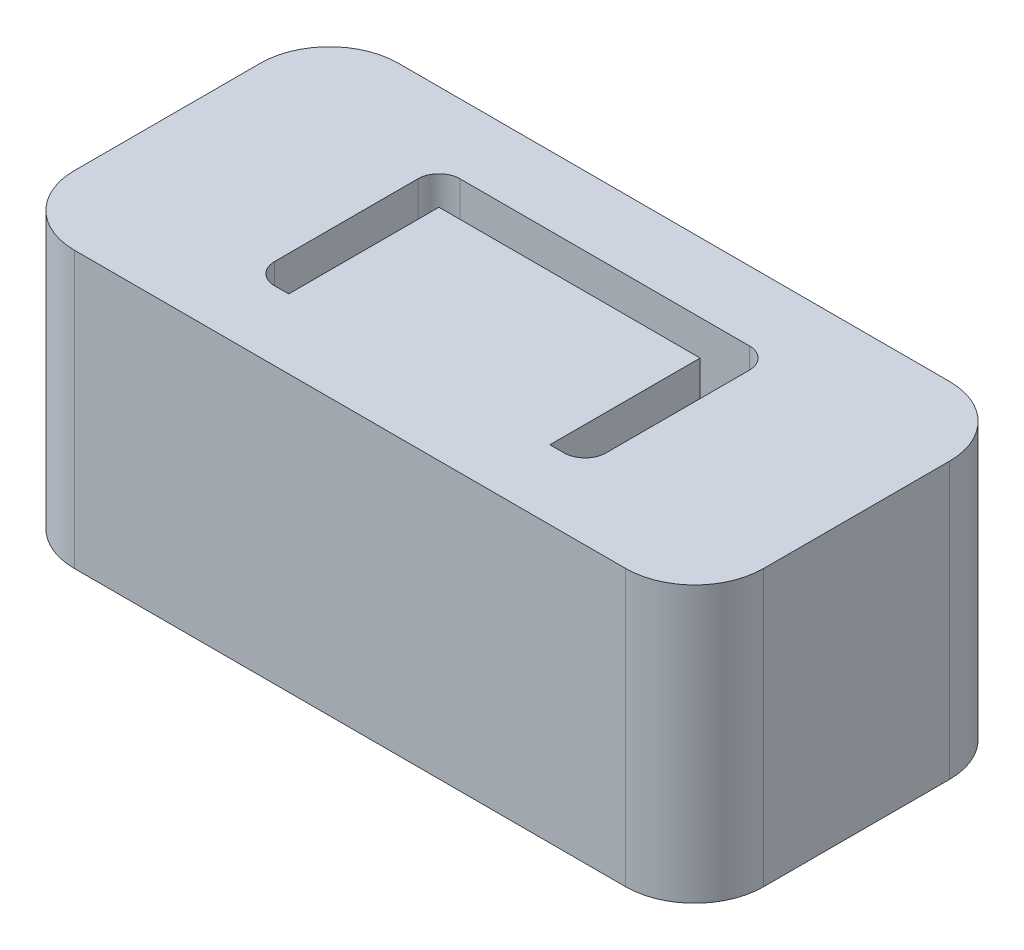
from build123d import *

# Parameters (mm, degrees)
SKETCH2_W                   = 100
SKETCH2_H                   = 47
BOSS_EXTRUDE1_DEPTH         = 40
FILLET1_R                   = 10
CUT_EXTRUDE1_REACH          = 70.207
M6_TAPPED_HOLE1_D           = 5
M6_TAPPED_HOLE1_DEPTH       = 17
M6_TAPPED_HOLE1_CSINK_D     = 6.05
M6_TAPPED_HOLE1_CSINK_ANGLE = 90
M6_TAPPED_HOLE1_TIP         = 1.502151548


with BuildPart() as part:
    # Sketch2 → Boss-Extrude1 (new body)
    with BuildSketch(Plane(origin=(0, 0, 0), x_dir=(1, 0, 0), z_dir=(0, 1, 0))):
        Rectangle(SKETCH2_W, SKETCH2_H)
    extrude(amount=-BOSS_EXTRUDE1_DEPTH)

    # Fillet1
    fillet1_edges = [part.edges().sort_by_distance(p)[0] for p in [
        (-50, -20, -23.5),
        (50, -20, -23.5),
        (50, -20, 23.5),
        (-50, -20, 23.5),
    ]]
    fillet(fillet1_edges, radius=FILLET1_R)

    # Sketch3 → Cut-Extrude1 (cut, up to next)
    with BuildSketch(Plane(origin=(0, 0, 0), x_dir=(1, 0, 0), z_dir=(0, 1, 0)), mode=Mode.PRIVATE) as cut_extrude1_sk1:
        with BuildLine():
            Line((24.05, -10.4), (24.05, 10.4))
            ThreePointArc((24.05, 10.4), (23.156675683, 12.556675683), (21, 13.45))
            Line((21, 13.45), (-21, 13.45))
            ThreePointArc((-21, 13.45), (-23.156675683, 12.556675683), (-24.05, 10.4))
            Line((-24.05, 10.4), (-24.05, -10.4))
            ThreePointArc((-24.05, -10.4), (-23.156675683, -12.556675683), (-21, -13.45))
            Line((-21, -13.45), (-18.95, -13.45))
            Line((-18.95, -13.45), (-18.95, 8.35))
            Line((-18.95, 8.35), (18.95, 8.35))
            Line((18.95, 8.35), (18.95, -13.45))
            Line((18.95, -13.45), (21, -13.45))
            ThreePointArc((21, -13.45), (23.156675683, -12.556675683), (24.05, -10.4))
        make_face()
    cut_extrude1_tool1 = extrude(cut_extrude1_sk1.sketch, amount=-CUT_EXTRUDE1_REACH, mode=Mode.PRIVATE) & part.part
    add(cut_extrude1_tool1.solids().sort_by_distance((23.49889, 0, 0))[0], mode=Mode.SUBTRACT)

    # M6 Tapped Hole1
    with Locations(Plane(origin=(0, -40, 0), x_dir=(-1, 0, 0), z_dir=(0, -1, 0))):
        with Locations((-43, 16.5), (43, 16.5), (43, -16.5), (-43, -16.5)):
            CounterSinkHole(M6_TAPPED_HOLE1_D / 2, M6_TAPPED_HOLE1_CSINK_D / 2, depth=M6_TAPPED_HOLE1_DEPTH, counter_sink_angle=M6_TAPPED_HOLE1_CSINK_ANGLE)
            with Locations((0, 0, -(M6_TAPPED_HOLE1_DEPTH + M6_TAPPED_HOLE1_TIP / 2))):  # 118° drill point
                Cone(0, M6_TAPPED_HOLE1_D / 2, M6_TAPPED_HOLE1_TIP, mode=Mode.SUBTRACT)


solid = part.part
